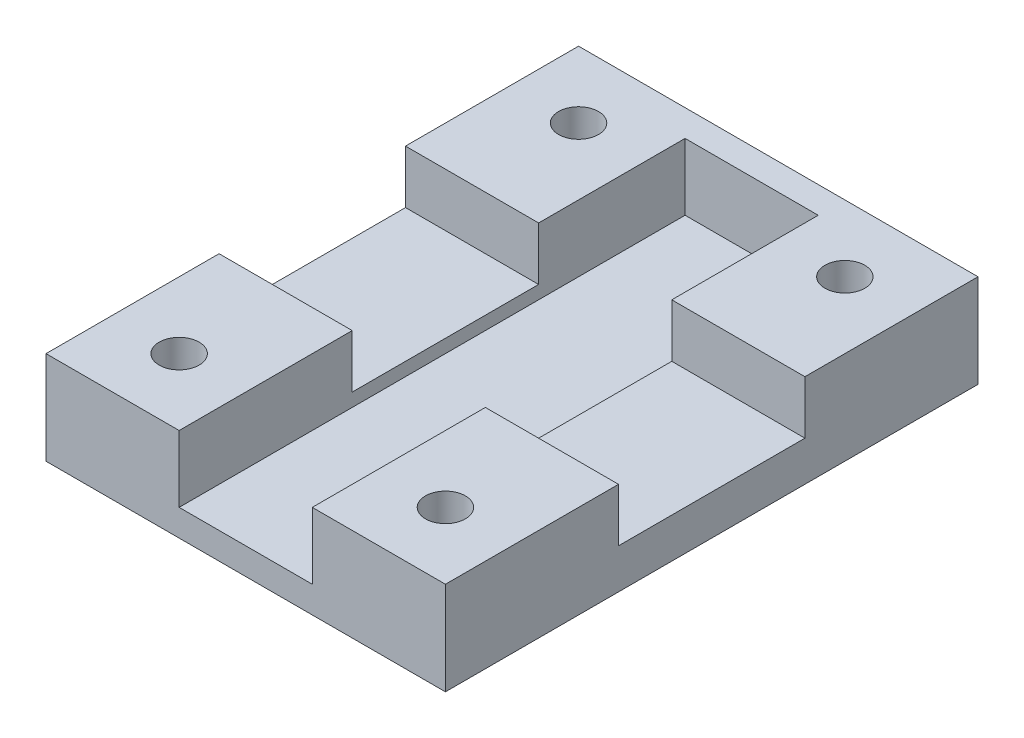
from build123d import *

# Parameters (mm, degrees)
BOSS_EXTRU_1_DEPTH      = 40
ENL_V_MAT_EXTRU_1_REACH = 45.29
ESQUISSE2_R             = 1.5
ESQUISSE3_W             = 10
ESQUISSE3_H             = 14
ENL_V_MAT_EXTRU_2_DEPTH = 4
ESQUISSE4_W             = 30
ESQUISSE4_H             = 7
BOSS_EXTRU_2_DEPTH      = 2


with BuildPart() as part:
    # Esquisse1 → Boss.-Extru.1 (new body)
    with BuildSketch(Plane.XY):
        Polygon((5, 0), (15, 0), (15, -7), (-15, -7), (-15, 0), (-5, 0), (-5, -5), (5, -5), align=None)
    extrude(amount=BOSS_EXTRU_1_DEPTH)

    # Esquisse2 → Enlèv. mat.-Extru.1 (cut, up to next)
    with BuildSketch(Plane(origin=(0, 0, 0), x_dir=(1, 0, 0), z_dir=(0, 1, 0)), mode=Mode.PRIVATE) as enl_v_mat_extru_1_sk1:
        with Locations((-10, -5)):
            Circle(ESQUISSE2_R)
    enl_v_mat_extru_1_tool1 = extrude(enl_v_mat_extru_1_sk1.sketch, amount=-ENL_V_MAT_EXTRU_1_REACH, mode=Mode.PRIVATE) & part.part
    # Esquisse2 → Enlèv. mat.-Extru.1 (cut, up to next)
    with BuildSketch(Plane(origin=(0, 0, 0), x_dir=(1, 0, 0), z_dir=(0, 1, 0)), mode=Mode.PRIVATE) as enl_v_mat_extru_1_sk2:
        with Locations((-10, -35)):
            Circle(ESQUISSE2_R)
    enl_v_mat_extru_1_tool2 = extrude(enl_v_mat_extru_1_sk2.sketch, amount=-ENL_V_MAT_EXTRU_1_REACH, mode=Mode.PRIVATE) & part.part
    # Esquisse2 → Enlèv. mat.-Extru.1 (cut, up to next)
    with BuildSketch(Plane(origin=(0, 0, 0), x_dir=(1, 0, 0), z_dir=(0, 1, 0)), mode=Mode.PRIVATE) as enl_v_mat_extru_1_sk3:
        with Locations((10, -35)):
            Circle(ESQUISSE2_R)
    enl_v_mat_extru_1_tool3 = extrude(enl_v_mat_extru_1_sk3.sketch, amount=-ENL_V_MAT_EXTRU_1_REACH, mode=Mode.PRIVATE) & part.part
    # Esquisse2 → Enlèv. mat.-Extru.1 (cut, up to next)
    with BuildSketch(Plane(origin=(0, 0, 0), x_dir=(1, 0, 0), z_dir=(0, 1, 0)), mode=Mode.PRIVATE) as enl_v_mat_extru_1_sk4:
        with Locations((10, -5)):
            Circle(ESQUISSE2_R)
    enl_v_mat_extru_1_tool4 = extrude(enl_v_mat_extru_1_sk4.sketch, amount=-ENL_V_MAT_EXTRU_1_REACH, mode=Mode.PRIVATE) & part.part
    add(enl_v_mat_extru_1_tool1.solids().sort_by_distance((-10, 0, 5))[0], mode=Mode.SUBTRACT)
    add(enl_v_mat_extru_1_tool2.solids().sort_by_distance((-10, 0, 35))[0], mode=Mode.SUBTRACT)
    add(enl_v_mat_extru_1_tool3.solids().sort_by_distance((10, 0, 35))[0], mode=Mode.SUBTRACT)
    add(enl_v_mat_extru_1_tool4.solids().sort_by_distance((10, 0, 5))[0], mode=Mode.SUBTRACT)

    # Esquisse3 → Enlèv. mat.-Extru.2 (cut)
    with BuildSketch(Plane(origin=(0, 0, 0), x_dir=(1, 0, 0), z_dir=(0, 1, 0))):
        with Locations((-10, -20)):
            Rectangle(ESQUISSE3_W, ESQUISSE3_H)
        with Locations((10, -20)):
            Rectangle(ESQUISSE3_W, ESQUISSE3_H)
    extrude(amount=-ENL_V_MAT_EXTRU_2_DEPTH, mode=Mode.SUBTRACT)

    # Esquisse4 → Boss.-Extru.2 (add)
    with BuildSketch(Plane(origin=(0, 0, 0), x_dir=(-1, 0, 0), z_dir=(0, 0, -1))):
        with Locations((0, -3.5)):
            Rectangle(ESQUISSE4_W, ESQUISSE4_H)
    extrude(amount=-BOSS_EXTRU_2_DEPTH)


solid = part.part
